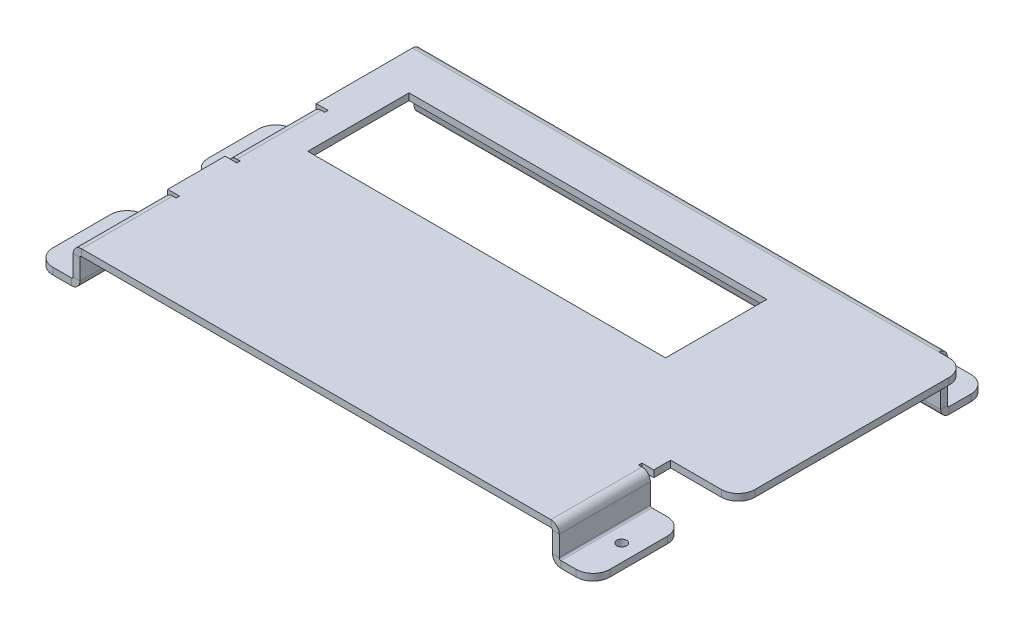
from build123d import *

# Parameters (mm, degrees)
SKETCH_2_W                        = 164
SKETCH_2_H                        = 2
SM_BASE_FLANGE_1_DEPTH            = 115
OTHER_START                       = -82
OTHER_1_DEPTH                     = 164
OTHER_1_2_DEPTH                   = 164
OTHER_1_3_DEPTH                   = 164
OTHER_1_3_2_DEPTH                 = 164
CUT_EXTRUDE_2_REACH               = 143.255
SKETCH_10_W                       = 8
SKETCH_10_H                       = 28.71238898
OTHER_1_4_DEPTH                   = 156
OTHER_1_4_2_DEPTH                 = 156
CUT_EXTRUDE_5_REACH               = 144.321
SKETCH_17_W                       = 20
SKETCH_17_H                       = 33
SM_EDGE_FLANGE_2_STRIP_W          = 9
SM_EDGE_FLANGE_2_STRIP_H          = 2
SM_EDGE_FLANGE_2_STRIP_CUT_DEPTH  = 27
SM_EDGE_FLANGE_2_RELIEF_W         = 10
SM_EDGE_FLANGE_2_RELIEF_H         = 1
SM_EDGE_FLANGE_2_RELIEF_CUT_DEPTH = 2
SM_EDGE_FLANGE_2_DEPTH            = 27
SM_EDGE_FLANGE_4_STRIP_W          = 9
SM_EDGE_FLANGE_4_STRIP_H          = 2
SM_EDGE_FLANGE_4_STRIP_CUT_DEPTH  = 27
SM_EDGE_FLANGE_4_DEPTH            = 27
SM_EDGE_FLANGE_6_STRIP_W          = 9
SM_EDGE_FLANGE_6_STRIP_H          = 2
SM_EDGE_FLANGE_6_STRIP_CUT_DEPTH  = 25
SM_EDGE_FLANGE_6_RELIEF_W         = 10
SM_EDGE_FLANGE_6_RELIEF_H         = 1
SM_EDGE_FLANGE_6_RELIEF_CUT_DEPTH = 2
SM_EDGE_FLANGE_6_DEPTH            = 25
SM_EDGE_FLANGE_8_STRIP_W          = 9
SM_EDGE_FLANGE_8_STRIP_H          = 2
SM_EDGE_FLANGE_8_STRIP_CUT_DEPTH  = 25
SM_EDGE_FLANGE_8_DEPTH            = 25
SM_EDGE_FLANGE_9_STRIP_W          = 9
SM_EDGE_FLANGE_9_STRIP_H          = 2
SM_EDGE_FLANGE_9_STRIP_CUT_DEPTH  = 27
SM_EDGE_FLANGE_9_RELIEF_W         = 10
SM_EDGE_FLANGE_9_RELIEF_H         = 1
SM_EDGE_FLANGE_9_RELIEF_CUT_DEPTH = 2
SM_EDGE_FLANGE_9_DEPTH            = 27
SM_EDGE_FLANGE_10_STRIP_W         = 9
SM_EDGE_FLANGE_10_STRIP_H         = 2
SM_EDGE_FLANGE_10_STRIP_CUT_DEPTH = 27
SM_EDGE_FLANGE_10_DEPTH           = 27
CUT_EXTRUDE_6_REACH               = 150.93
SKETCH_45_W                       = 106
SKETCH_45_H                       = 30
FILLET_1_R                        = 5
HOLE_WIZARD_M3_1_D                = 3.4
HOLE_WIZARD_M2_5_1_D              = 2.9


# Read off the part's stored shape, not the designer's step: ｼﾞｮｸﾞ1, ｱﾝﾌｫｰﾙﾄﾞ1, ﾌｫｰﾙﾄﾞ1
# Sheet-metal steps are written as plain solids
with BuildPart() as part:
    # Sketch 2 → ﾍﾞｰｽ-ﾌﾗﾝｼﾞ1 (new body)
    with BuildSketch(Plane.XY):
        with Locations((0, -1)):
            Rectangle(SKETCH_2_W, SKETCH_2_H)
    extrude(amount=SM_BASE_FLANGE_1_DEPTH)

    # Other 1 outline → Other 1 (cut)
    with BuildSketch(Plane.YZ.offset(OTHER_START)):
        with BuildLine():
            ThreePointArc((0, 14.5), (-0.563508327, 12.91886117), (-2, 12.050510257))
            Line((-2, 12.050510257), (-2, 0))
            Line((-2, 0), (0, 0))
            Line((0, 0), (0, 14.5))
        make_face()
    extrude(amount=OTHER_1_DEPTH, mode=Mode.SUBTRACT)

    # Other 1 2 outline → Other 1 2 (add)
    with BuildSketch(Plane.YZ.offset(OTHER_START)):
        with BuildLine():
            ThreePointArc((-15.5, 11.5), (-15.353553391, 11.853553391), (-15, 12))
            Line((-15, 12), (-2.5, 12))
            ThreePointArc((-2.5, 12), (-2.248727595, 12.012659617), (-2, 12.050510257))
            Line((-2, 12.050510257), (-2, 14.5))
            ThreePointArc((-2, 14.5), (-2.146446609, 14.146446609), (-2.5, 14))
            Line((-2.5, 14), (-15, 14))
            ThreePointArc((-15, 14), (-16.767766953, 13.267766953), (-17.5, 11.5))
            Line((-17.5, 11.5), (-17.5, 0))
            Line((-17.5, 0), (-15.5, 0))
            Line((-15.5, 0), (-15.5, 11.5))
        make_face()
    extrude(amount=OTHER_1_2_DEPTH)

    # Other 1 3 outline → Other 1 3 (cut)
    with BuildSketch(Plane.YZ.offset(OTHER_START)):
        with BuildLine():
            ThreePointArc((-2.5, 12), (-2.248727595, 12.012659617), (-2, 12.050510257))
            Line((-2, 12.050510257), (-2, 14.5))
            ThreePointArc((-2, 14.5), (-2.146446609, 14.146446609), (-2.5, 14))
            Line((-2.5, 14), (-15, 14))
            ThreePointArc((-15, 14), (-16.767766953, 13.267766953), (-17.5, 11.5))
            Line((-17.5, 11.5), (-17.5, 0))
            Line((-17.5, 0), (-15.5, 0))
            Line((-15.5, 0), (-15.5, 11.5))
            ThreePointArc((-15.5, 11.5), (-15.353553391, 11.853553391), (-15, 12))
            Line((-15, 12), (-2.5, 12))
        make_face()
    extrude(amount=OTHER_1_3_DEPTH, mode=Mode.SUBTRACT)

    # Other 1 3 2 outline → Other 1 3 2 (add)
    with BuildSketch(Plane.YZ.offset(OTHER_START)):
        with BuildLine():
            Line((0, -14.21238898), (0, 14.5))
            ThreePointArc((0, 14.5), (-0.563508327, 12.91886117), (-2, 12.050510257))
            Line((-2, 12.050510257), (-2, -14.21238898))
            Line((-2, -14.21238898), (0, -14.21238898))
        make_face()
    extrude(amount=OTHER_1_3_2_DEPTH)

    # ｽｹｯﾁ10 → ｶｯﾄ - 押し出し2 (cut, up to next)
    with BuildSketch(Plane(origin=(0, 0, 0), x_dir=(1, 0, 0), z_dir=(0, 1, 0)), mode=Mode.PRIVATE) as cut_extrude_2_sk1:
        with Locations((78, -0.14380551)):
            Rectangle(SKETCH_10_W, SKETCH_10_H)
    cut_extrude_2_tool1 = extrude(cut_extrude_2_sk1.sketch, amount=-CUT_EXTRUDE_2_REACH, mode=Mode.PRIVATE) & part.part
    add(cut_extrude_2_tool1.solids().sort_by_distance((78, 0, 0.143806))[0], mode=Mode.SUBTRACT)

    # Other 1 4 outline → Other 1 4 (cut)
    with BuildSketch(Plane.YZ.offset(OTHER_START)):
        with BuildLine():
            ThreePointArc((0, 14.5), (-0.563508327, 12.91886117), (-2, 12.050510257))
            Line((-2, 12.050510257), (-2, -14.21238898))
            Line((-2, -14.21238898), (0, -14.21238898))
            Line((0, -14.21238898), (0, 14.5))
        make_face()
    extrude(amount=OTHER_1_4_DEPTH, mode=Mode.SUBTRACT)

    # Other 1 4 2 outline → Other 1 4 2 (add)
    with BuildSketch(Plane.YZ.offset(OTHER_START)):
        with BuildLine():
            ThreePointArc((-15.5, 11.5), (-15.353553391, 11.853553391), (-15, 12))
            Line((-15, 12), (-2.5, 12))
            ThreePointArc((-2.5, 12), (-2.248727595, 12.012659617), (-2, 12.050510257))
            Line((-2, 12.050510257), (-2, 14.5))
            ThreePointArc((-2, 14.5), (-2.146446609, 14.146446609), (-2.5, 14))
            Line((-2.5, 14), (-15, 14))
            ThreePointArc((-15, 14), (-16.767766953, 13.267766953), (-17.5, 11.5))
            Line((-17.5, 11.5), (-17.5, 0))
            Line((-17.5, 0), (-15.5, 0))
            Line((-15.5, 0), (-15.5, 11.5))
        make_face()
    extrude(amount=OTHER_1_4_2_DEPTH)

    # ｽｹｯﾁ17 → ｶｯﾄ - 押し出し5 (cut, up to next)
    with BuildSketch(Plane(origin=(0, 0, 0), x_dir=(1, 0, 0), z_dir=(0, 1, 0)), mode=Mode.PRIVATE) as cut_extrude_5_sk1:
        with Locations((72, -98.5)):
            Rectangle(SKETCH_17_W, SKETCH_17_H)
    cut_extrude_5_tool1 = extrude(cut_extrude_5_sk1.sketch, amount=-CUT_EXTRUDE_5_REACH, mode=Mode.PRIVATE) & part.part
    add(cut_extrude_5_tool1.solids().sort_by_distance((72, 0, 98.5))[0], mode=Mode.SUBTRACT)

    # ｴｯｼﾞ-ﾌﾗﾝｼﾞ2 strip (across the edge) → ｴｯｼﾞ-ﾌﾗﾝｼﾞ2 strip cut (cut)
    with BuildSketch(Plane(origin=(62, -2, 88), x_dir=(-1, 0, 0), z_dir=(0, 0, 1))):
        with Locations((-2, -1)):
            Rectangle(SM_EDGE_FLANGE_2_STRIP_W, SM_EDGE_FLANGE_2_STRIP_H)
    extrude(amount=SM_EDGE_FLANGE_2_STRIP_CUT_DEPTH, mode=Mode.SUBTRACT)

    # ｴｯｼﾞ-ﾌﾗﾝｼﾞ2 relief (on the sheet) → ｴｯｼﾞ-ﾌﾗﾝｼﾞ2 relief cut (cut)
    with BuildSketch(Plane(origin=(59.5, -2, 88), x_dir=(-1, 0, 0), z_dir=(0, -1, 0))):
        with Locations((-4, 0.5)):
            Rectangle(SM_EDGE_FLANGE_2_RELIEF_W, SM_EDGE_FLANGE_2_RELIEF_H)
    extrude(amount=-SM_EDGE_FLANGE_2_RELIEF_CUT_DEPTH, mode=Mode.SUBTRACT)

    # ｴｯｼﾞ-ﾌﾗﾝｼﾞ2 section (across the edge) → ｴｯｼﾞ-ﾌﾗﾝｼﾞ2 (add)
    with BuildSketch(Plane(origin=(62, -2, 88), x_dir=(-1, 0, 0), z_dir=(0, 0, 1))):
        with BuildLine():
            Line((0, 0.5), (0, 9))
            Line((0, 9), (2, 9))
            Line((2, 9), (2, 0.5))
            ThreePointArc((2, 0.5), (2.146446609, 0.146446609), (2.5, 0))
            Line((2.5, 0), (2.5, -2))
            ThreePointArc((2.5, -2), (0.732233047, -1.267766953), (0, 0.5))
        make_face()
    extrude(amount=SM_EDGE_FLANGE_2_DEPTH)

    # ｴｯｼﾞ-ﾌﾗﾝｼﾞ4 strip (across the edge) → ｴｯｼﾞ-ﾌﾗﾝｼﾞ4 strip cut (cut)
    with BuildSketch(Plane(origin=(62, -11, 115), x_dir=(0, 1, 0), z_dir=(0, 0, -1))):
        with Locations((-2, -1)):
            Rectangle(SM_EDGE_FLANGE_4_STRIP_W, SM_EDGE_FLANGE_4_STRIP_H)
    extrude(amount=SM_EDGE_FLANGE_4_STRIP_CUT_DEPTH, mode=Mode.SUBTRACT)

    # ｴｯｼﾞ-ﾌﾗﾝｼﾞ4 section (across the edge) → ｴｯｼﾞ-ﾌﾗﾝｼﾞ4 (add)
    with BuildSketch(Plane(origin=(62, -11, 115), x_dir=(0, 1, 0), z_dir=(0, 0, -1))):
        with BuildLine():
            Line((0, 0.5), (0, 10))
            Line((0, 10), (2, 10))
            Line((2, 10), (2, 0.5))
            ThreePointArc((2, 0.5), (2.146446609, 0.146446609), (2.5, 0))
            Line((2.5, 0), (2.5, -2))
            ThreePointArc((2.5, -2), (0.732233047, -1.267766953), (0, 0.5))
        make_face()
    extrude(amount=SM_EDGE_FLANGE_4_DEPTH)

    # ｴｯｼﾞ-ﾌﾗﾝｼﾞ6 strip (across the edge) → ｴｯｼﾞ-ﾌﾗﾝｼﾞ6 strip cut (cut)
    with BuildSketch(Plane(origin=(-82, -2, 69), x_dir=(1, 0, 0), z_dir=(0, 0, -1))):
        with Locations((-2, -1)):
            Rectangle(SM_EDGE_FLANGE_6_STRIP_W, SM_EDGE_FLANGE_6_STRIP_H)
    extrude(amount=SM_EDGE_FLANGE_6_STRIP_CUT_DEPTH, mode=Mode.SUBTRACT)

    # ｴｯｼﾞ-ﾌﾗﾝｼﾞ6 relief (on the sheet) → ｴｯｼﾞ-ﾌﾗﾝｼﾞ6 relief cut (cut)
    with BuildSketch(Plane(origin=(-79.5, -2, 69), x_dir=(1, 0, 0), z_dir=(0, -1, 0))):
        with Locations((-4, 0.5)):
            Rectangle(SM_EDGE_FLANGE_6_RELIEF_W, SM_EDGE_FLANGE_6_RELIEF_H)
        with Locations((-4, -25.5)):
            Rectangle(SM_EDGE_FLANGE_6_RELIEF_W, SM_EDGE_FLANGE_6_RELIEF_H)
    extrude(amount=-SM_EDGE_FLANGE_6_RELIEF_CUT_DEPTH, mode=Mode.SUBTRACT)

    # ｴｯｼﾞ-ﾌﾗﾝｼﾞ6 section (across the edge) → ｴｯｼﾞ-ﾌﾗﾝｼﾞ6 (add)
    with BuildSketch(Plane(origin=(-82, -2, 69), x_dir=(1, 0, 0), z_dir=(0, 0, -1))):
        with BuildLine():
            Line((0, 0.5), (0, 9))
            Line((0, 9), (2, 9))
            Line((2, 9), (2, 0.5))
            ThreePointArc((2, 0.5), (2.146446609, 0.146446609), (2.5, 0))
            Line((2.5, 0), (2.5, -2))
            ThreePointArc((2.5, -2), (0.732233047, -1.267766953), (0, 0.5))
        make_face()
    extrude(amount=SM_EDGE_FLANGE_6_DEPTH)

    # ｴｯｼﾞ-ﾌﾗﾝｼﾞ8 strip (across the edge) → ｴｯｼﾞ-ﾌﾗﾝｼﾞ8 strip cut (cut)
    with BuildSketch(Plane(origin=(-82, -11, 44), x_dir=(0, 1, 0), z_dir=(0, 0, 1))):
        with Locations((-2, -1)):
            Rectangle(SM_EDGE_FLANGE_8_STRIP_W, SM_EDGE_FLANGE_8_STRIP_H)
    extrude(amount=SM_EDGE_FLANGE_8_STRIP_CUT_DEPTH, mode=Mode.SUBTRACT)

    # ｴｯｼﾞ-ﾌﾗﾝｼﾞ8 section (across the edge) → ｴｯｼﾞ-ﾌﾗﾝｼﾞ8 (add)
    with BuildSketch(Plane(origin=(-82, -11, 44), x_dir=(0, 1, 0), z_dir=(0, 0, 1))):
        with BuildLine():
            Line((0, 0.5), (0, 11))
            Line((0, 11), (2, 11))
            Line((2, 11), (2, 0.5))
            ThreePointArc((2, 0.5), (2.146446609, 0.146446609), (2.5, 0))
            Line((2.5, 0), (2.5, -2))
            ThreePointArc((2.5, -2), (0.732233047, -1.267766953), (0, 0.5))
        make_face()
    extrude(amount=SM_EDGE_FLANGE_8_DEPTH)

    # ｴｯｼﾞ-ﾌﾗﾝｼﾞ9 strip (across the edge) → ｴｯｼﾞ-ﾌﾗﾝｼﾞ9 strip cut (cut)
    with BuildSketch(Plane(origin=(-82, -2, 115), x_dir=(1, 0, 0), z_dir=(0, 0, -1))):
        with Locations((-2, -1)):
            Rectangle(SM_EDGE_FLANGE_9_STRIP_W, SM_EDGE_FLANGE_9_STRIP_H)
    extrude(amount=SM_EDGE_FLANGE_9_STRIP_CUT_DEPTH, mode=Mode.SUBTRACT)

    # ｴｯｼﾞ-ﾌﾗﾝｼﾞ9 relief (on the sheet) → ｴｯｼﾞ-ﾌﾗﾝｼﾞ9 relief cut (cut)
    with BuildSketch(Plane(origin=(-79.5, -2, 115), x_dir=(1, 0, 0), z_dir=(0, -1, 0))):
        with Locations((-4, -27.5)):
            Rectangle(SM_EDGE_FLANGE_9_RELIEF_W, SM_EDGE_FLANGE_9_RELIEF_H)
    extrude(amount=-SM_EDGE_FLANGE_9_RELIEF_CUT_DEPTH, mode=Mode.SUBTRACT)

    # ｴｯｼﾞ-ﾌﾗﾝｼﾞ9 section (across the edge) → ｴｯｼﾞ-ﾌﾗﾝｼﾞ9 (add)
    with BuildSketch(Plane(origin=(-82, -2, 115), x_dir=(1, 0, 0), z_dir=(0, 0, -1))):
        with BuildLine():
            Line((0, 0.5), (0, 9))
            Line((0, 9), (2, 9))
            Line((2, 9), (2, 0.5))
            ThreePointArc((2, 0.5), (2.146446609, 0.146446609), (2.5, 0))
            Line((2.5, 0), (2.5, -2))
            ThreePointArc((2.5, -2), (0.732233047, -1.267766953), (0, 0.5))
        make_face()
    extrude(amount=SM_EDGE_FLANGE_9_DEPTH)

    # ｴｯｼﾞ-ﾌﾗﾝｼﾞ10 strip (across the edge) → ｴｯｼﾞ-ﾌﾗﾝｼﾞ10 strip cut (cut)
    with BuildSketch(Plane(origin=(-82, -11, 88), x_dir=(0, 1, 0), z_dir=(0, 0, 1))):
        with Locations((-2, -1)):
            Rectangle(SM_EDGE_FLANGE_10_STRIP_W, SM_EDGE_FLANGE_10_STRIP_H)
    extrude(amount=SM_EDGE_FLANGE_10_STRIP_CUT_DEPTH, mode=Mode.SUBTRACT)

    # ｴｯｼﾞ-ﾌﾗﾝｼﾞ10 section (across the edge) → ｴｯｼﾞ-ﾌﾗﾝｼﾞ10 (add)
    with BuildSketch(Plane(origin=(-82, -11, 88), x_dir=(0, 1, 0), z_dir=(0, 0, 1))):
        with BuildLine():
            Line((0, 0.5), (0, 11))
            Line((0, 11), (2, 11))
            Line((2, 11), (2, 0.5))
            ThreePointArc((2, 0.5), (2.146446609, 0.146446609), (2.5, 0))
            Line((2.5, 0), (2.5, -2))
            ThreePointArc((2.5, -2), (0.732233047, -1.267766953), (0, 0.5))
        make_face()
    extrude(amount=SM_EDGE_FLANGE_10_DEPTH)

    # ｽｹｯﾁ45 → ｶｯﾄ - 押し出し6 (cut, up to next)
    with BuildSketch(Plane(origin=(0, 0, 0), x_dir=(1, 0, 0), z_dir=(0, 1, 0)), mode=Mode.PRIVATE) as cut_extrude_6_sk1:
        with Locations((-18, -41.5)):
            Rectangle(SKETCH_45_W, SKETCH_45_H)
    cut_extrude_6_tool1 = extrude(cut_extrude_6_sk1.sketch, amount=-CUT_EXTRUDE_6_REACH, mode=Mode.PRIVATE) & part.part
    add(cut_extrude_6_tool1.solids().sort_by_distance((-18, 0, 41.5))[0], mode=Mode.SUBTRACT)

    # ﾌｨﾚｯﾄ1
    fillet_1_edges = [part.edges().sort_by_distance(p)[0] for p in [
        (-82, -16.5, 0),
        (74, -16.5, 0),
        (82, -1, 14.5),
        (82, -1, 82),
        (72, -10, 115),
        (72, -10, 88),
        (-93, -10, 44),
        (-93, -10, 69),
        (-93, -10, 88),
        (-93, -10, 115),
    ]]
    fillet(fillet_1_edges, radius=FILLET_1_R)

    # M3 すきま穴1 (through all)
    with Locations(Plane(origin=(0, -15.5, 0), x_dir=(1, 0, 0), z_dir=(0, 1, 0))):
        with Locations((66, -4.5), (-74, -4.5)):
            Hole(HOLE_WIZARD_M3_1_D / 2)

    # M2.5 すきま穴1 (through all)
    with Locations(Plane(origin=(0, -9, 0), x_dir=(1, 0, 0), z_dir=(0, 1, 0))):
        with Locations((-88, -101.5), (67, -101.5), (-87.5, -56.5)):
            Hole(HOLE_WIZARD_M2_5_1_D / 2)


solid = part.part
